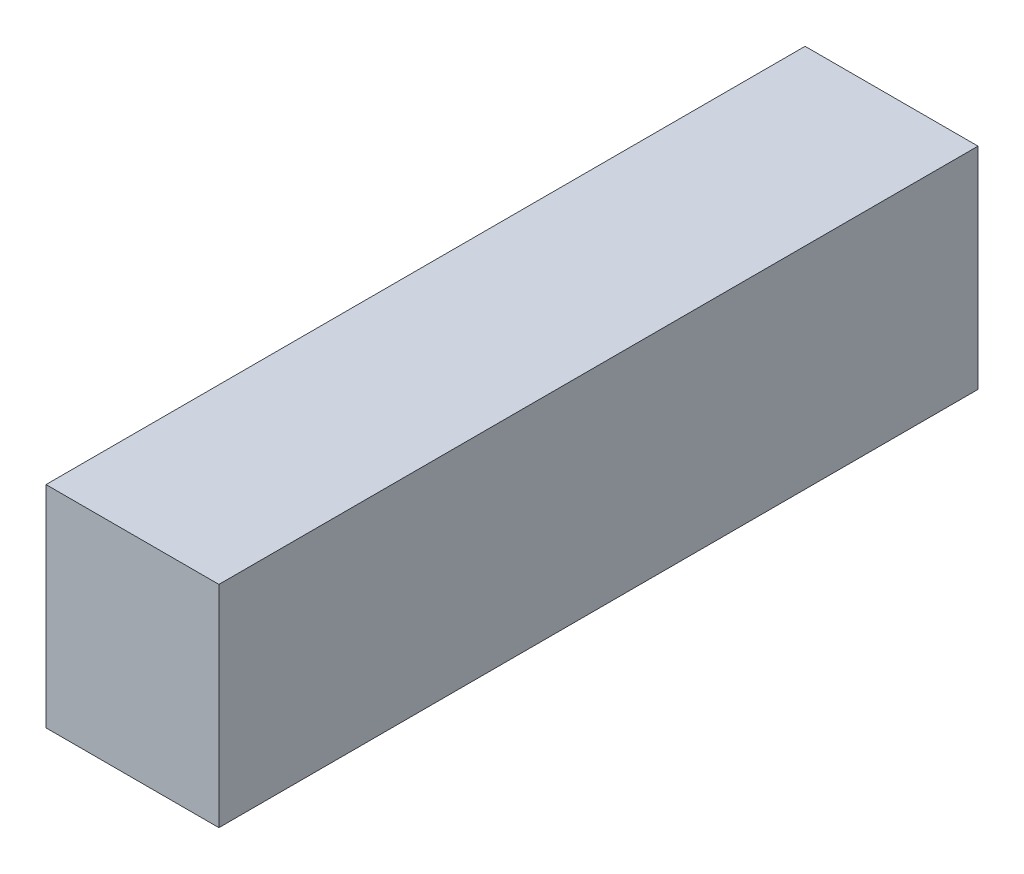
from build123d import *

# Parameters (mm, degrees)
SKETCH1_W           = 131.70814305
SKETCH1_H           = 36.561123322
BOSS_EXTRUDE1_DEPTH = 30
SHELL1_T            = 10


with BuildPart() as part:
    # Sketch1 → Boss-Extrude1 (new body)
    with BuildSketch(Plane(origin=(0, 0, 0), x_dir=(0, 0, -1), z_dir=(1, 0, 0))):
        with Locations((16.959075276, 7.158051253)):
            Rectangle(SKETCH1_W, SKETCH1_H)
    extrude(amount=BOSS_EXTRUDE1_DEPTH)

    # Shell1 (no face opened: a closed hollow body)
    add(offset(amount=-SHELL1_T, mode=Mode.PRIVATE), mode=Mode.SUBTRACT)


solid = part.part
